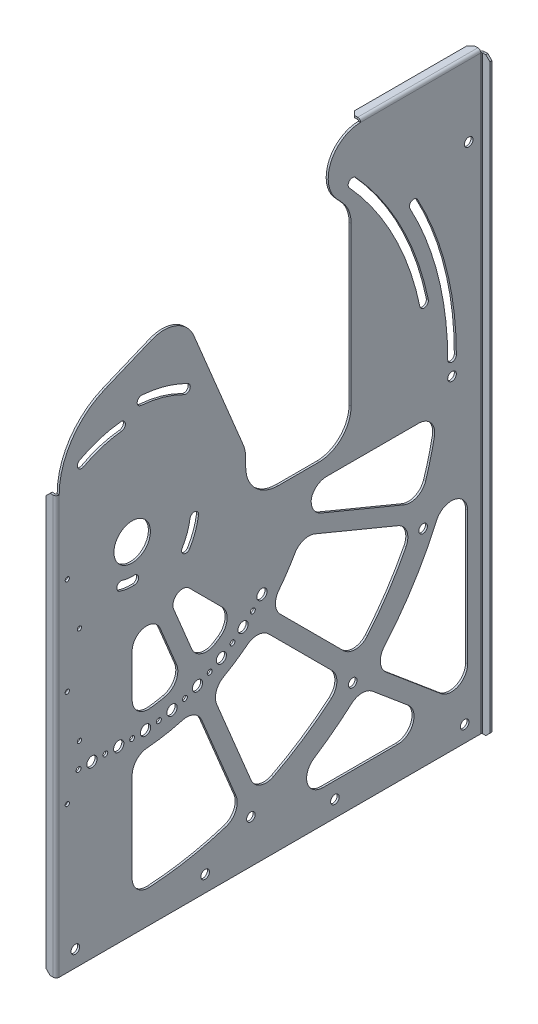
from build123d import *

# Parameters (mm, degrees)
SKETCH1_W                 = 330.2
SKETCH1_H                 = 558.8
BASE_FLANGE1_DEPTH        = 1.5875
SKETCH7_R                 = 3.3782
CUT_EXTRUDE1_DEPTH        = 650.070104192
SKETCH11_R                = 3.3782
CUT_EXTRUDE2_DEPTH        = 650.070104192
CUT_EXTRUDE3_DEPTH        = 650.070104192
CUT_EXTRUDE3_DEPTH_BACK   = 650.070104192
SKETCH20_R                = 1.651
CUT_EXTRUDE5_DEPTH        = 2.54
EDGE_FLANGE3_DEPTH        = 327.025
EDGE_FLANGE4_DEPTH        = 491.294820266
SKETCH34_R                = 14.2875
CUT_EXTRUDE6_DEPTH        = 594.74051043
CUT_EXTRUDE7_DEPTH        = 594.74051043
CUT_EXTRUDE15_DEPTH       = 594.74051043
CUT_EXTRUDE10_DEPTH       = 594.74051043
CUT_EXTRUDE11_DEPTH       = 594.74051043
CUT_EXTRUDE13_DEPTH       = 594.74051043
FILLET2_R                 = 12.7
FILLET3_START             = -1.5875
FILLET3_DEPTH             = 1.5875
FILLET5_START             = -1.5875
FILLET5_DEPTH             = 1.5875
SKETCH56_R                = 1.905
SKETCH56_R_2              = 4
CUT_EXTRUDE14_DEPTH       = 594.740510512
FILLET6_R                 = 25.4
CUT_EXTRUDE16_DEPTH       = 594.740510512
CUT_EXTRUDE16_DEPTH_BACK  = 594.740510512
EDGE_FLANGE7_DEPTH        = 94.134987421
BREAK_CORNER1_START       = 328.750604804
BREAK_CORNER1_OUTLINE_W   = 324
BREAK_CORNER1_OUTLINE_H   = 338
BREAK_CORNER1_DEPTH       = 3.249395196
BREAK_CORNER1_START_2     = -5.612660076
BREAK_CORNER1_2_OUTLINE_W = 324
BREAK_CORNER1_2_OUTLINE_H = 338
BREAK_CORNER1_2_DEPTH     = 2.245064031
BREAK_CORNER1_START_3     = 2.24506403
BREAK_CORNER1_3_OUTLINE_W = 228
BREAK_CORNER1_3_OUTLINE_H = 338
BREAK_CORNER1_3_DEPTH     = 2.75493597
BREAK_CORNER1_START_4     = -236.854255193
BREAK_CORNER1_4_OUTLINE_W = 228
BREAK_CORNER1_4_OUTLINE_H = 338
BREAK_CORNER1_4_DEPTH     = 2.24506403
BREAK_CORNER1_START_5     = -240
BREAK_CORNER1_5_OUTLINE_W = 8
BREAK_CORNER1_5_OUTLINE_H = 5
BREAK_CORNER1_5_DEPTH     = 3.145744807
BREAK_CORNER1_START_6     = 160
BREAK_CORNER1_6_OUTLINE_W = 7
BREAK_CORNER1_6_OUTLINE_H = 5
BREAK_CORNER1_6_DEPTH     = 3.55557515


with BuildPart() as part:
    # Base-Flange1: sheet metal written as solids
    # Sketch1 → Base-Flange1 (new body)
    with BuildSketch(Plane(origin=(0, 0, 0), x_dir=(0, 0, -1), z_dir=(1, 0, 0))):
        with Locations((165.1, 279.4)):
            Rectangle(SKETCH1_W, SKETCH1_H)
    extrude(amount=-BASE_FLANGE1_DEPTH)

    # Sketch7 → Cut-Extrude1 (cut, through all)
    with BuildSketch(Plane(origin=(0, 0, 0), x_dir=(0, 0, -1), z_dir=(1, 0, 0))):
        with Locations((12.7, 12.7)):
            Circle(SKETCH7_R)
        with Locations((114.3, 12.7)):
            Circle(SKETCH7_R)
        with Locations((215.9, 12.7)):
            Circle(SKETCH7_R)
        with Locations((317.5, 12.7)):
            Circle(SKETCH7_R)
    extrude(amount=-CUT_EXTRUDE1_DEPTH, mode=Mode.SUBTRACT)

    # Sketch11 → Cut-Extrude2 (cut, through all)
    with BuildSketch(Plane(origin=(0, 0, 0), x_dir=(0, 0, -1), z_dir=(1, 0, 0))):
        with Locations((150.127153555, 33.744146797)):
            Circle(SKETCH11_R)
        with Locations((229.85664515, 84.805537891)):
            Circle(SKETCH11_R)
        with Locations((284.978379186, 161.78379409)):
            Circle(SKETCH11_R)
        with Locations((307.638446704, 253.710824013)):
            Circle(SKETCH11_R)
        with Locations((320.675, 406.110824013)):
            Circle(SKETCH11_R)
    extrude(amount=-CUT_EXTRUDE2_DEPTH, mode=Mode.SUBTRACT)

    # Sketch12 → Cut-Extrude3 (cut, two sides: drawn at the far end of the back side and taken through both)
    with BuildSketch(Plane(origin=(0, 0, 0), x_dir=(0, 0, -1), z_dir=(1, 0, 0)).offset(-CUT_EXTRUDE3_DEPTH_BACK)):
        with BuildLine():
            Line((0, -866.871347525), (0, 327.025))
            ThreePointArc((0, 327.025), (9.845545249, 359.481413013), (36.063633881, 380.998042289))
            Line((36.063633881, 380.998042289), (287.873339559, 485.301037518))
            ThreePointArc((287.873339559, 485.301037518), (308.657009809, 490.978996813), (330.2, 491.294820266))
            Line((330.2, 491.294820266), (1516.701976399, 358.623992149))
            Line((1516.701976399, 358.623992149), (16.017291967, 2215.906801104))
            Line((16.017291967, 2215.906801104), (-1500.684684433, 990.41146143))
            Line((-1500.684684433, 990.41146143), (0, -866.871347525))
        make_face()
    extrude(amount=CUT_EXTRUDE3_DEPTH + CUT_EXTRUDE3_DEPTH_BACK, mode=Mode.SUBTRACT)

    # Sketch20 → Cut-Extrude5 (cut)
    with BuildSketch(Plane.ZY.offset(1.5875)):
        with Locations((-6.35, 114.3)):
            Circle(SKETCH20_R)
        with Locations((-15.875, 152.4)):
            Circle(SKETCH20_R)
        with Locations((-6.35, 190.5)):
            Circle(SKETCH20_R)
        with Locations((-15.875, 228.6)):
            Circle(SKETCH20_R)
        with Locations((-6.35, 266.7)):
            Circle(SKETCH20_R)
    extrude(amount=-CUT_EXTRUDE5_DEPTH, mode=Mode.SUBTRACT)

    # Edge-Flange3: sheet metal written as solids
    # Edge-Flange3 section (on a plane across the edge) → Edge-Flange3 (add)
    with BuildSketch(Plane(origin=(-1.5875, 0, 0.7366), x_dir=(0, 0, -1), z_dir=(0, 1, 0))):
        with BuildLine():
            Line((-1.5875, 0.7366), (-1.5875, 6.35))
            Line((-1.5875, 6.35), (0, 6.35))
            Line((0, 6.35), (0, 0.7366))
            ThreePointArc((0, 0.7366), (0.215745145, 0.215745145), (0.7366, 0))
            Line((0.7366, 0), (0.7366, -1.5875))
            ThreePointArc((0.7366, -1.5875), (-0.90678687, -0.90678687), (-1.5875, 0.7366))
        make_face()
    extrude(amount=EDGE_FLANGE3_DEPTH)

    # Edge-Flange4: sheet metal written as solids
    # Edge-Flange4 section (on a plane across the edge) → Edge-Flange4 (add)
    with BuildSketch(Plane(origin=(0, 0, -330.9366), x_dir=(0, 0, 1), z_dir=(0, 1, 0))):
        with BuildLine():
            Line((-1.5875, 0.7366), (-1.5875, 6.35))
            Line((-1.5875, 6.35), (0, 6.35))
            Line((0, 6.35), (0, 0.7366))
            ThreePointArc((0, 0.7366), (0.215745145, 0.215745145), (0.7366, 0))
            Line((0.7366, 0), (0.7366, -1.5875))
            ThreePointArc((0.7366, -1.5875), (-0.90678687, -0.90678687), (-1.5875, 0.7366))
        make_face()
    extrude(amount=EDGE_FLANGE4_DEPTH)

    # Sketch34 → Cut-Extrude6 (cut, through all)
    with BuildSketch(Plane.ZY.offset(1.5875)):
        with Locations((-57.15, 266.7)):
            Circle(SKETCH34_R)
    extrude(amount=-CUT_EXTRUDE6_DEPTH, mode=Mode.SUBTRACT)

    # Sketch35 → Cut-Extrude7 (cut, through all)
    with BuildSketch(Plane(origin=(0, 0, 0), x_dir=(0, 0, -1), z_dir=(1, 0, 0))):
        with BuildLine():
            Line((228.6, 406.4), (228.6, 247.65))
            Line((228.6, 247.65), (146.05, 247.65))
            Line((146.05, 247.65), (146.05, 284.38330946))
            Line((146.05, 284.38330946), (95.784403228, 405.735194908))
            Line((95.784403228, 405.735194908), (188.923415984, 444.314637178))
            ThreePointArc((188.923415984, 444.314637178), (209.942309782, 426.592784614), (228.6, 406.4))
        make_face()
    extrude(amount=-CUT_EXTRUDE7_DEPTH, mode=Mode.SUBTRACT)

    # Sketch57 → Cut-Extrude15 (cut, through all)
    with BuildSketch(Plane.ZY.offset(1.5875)):
        with BuildLine():
            ThreePointArc((-64.745880713, 362.454760351), (-83.280755026, 359.132976667), (-100.811439078, 352.259045526))
            ThreePointArc((-100.811439078, 352.259045526), (-102.284945526, 347.714460922), (-97.740360922, 346.240954474))
            ThreePointArc((-97.740360922, 346.240954474), (-81.442758096, 352.63138392), (-64.211598201, 355.719518473))
            ThreePointArc((-64.211598201, 355.719518473), (-61.111118518, 359.354280668), (-64.745880713, 362.454760351))
        make_face()
        with BuildLine():
            ThreePointArc((-15.933801681, 342.615684562), (-31.536174722, 349.197867372), (-48.122872704, 352.609703405))
            ThreePointArc((-48.122872704, 352.609703405), (-51.835603405, 349.603027296), (-48.828927296, 345.890296595))
            ThreePointArc((-48.828927296, 345.890296595), (-33.539553912, 342.745316498), (-19.157516729, 336.677957535))
            ThreePointArc((-19.157516729, 336.677957535), (-14.576795692, 338.034963524), (-15.933801681, 342.615684562))
        make_face()
        with BuildLine():
            ThreePointArc((-59.071100472, 236.542659122), (-53.150781722, 236.747335861), (-47.384150688, 238.103076685))
            ThreePointArc((-47.384150688, 238.103076685), (-45.278976685, 242.391749312), (-49.567649312, 244.496923315))
            ThreePointArc((-49.567649312, 244.496923315), (-54.044947435, 243.44430597), (-58.641570986, 243.285391905))
            ThreePointArc((-58.641570986, 243.285391905), (-62.227702121, 240.128790257), (-59.071100472, 236.542659122))
        make_face()
        with BuildLine():
            ThreePointArc((-109.129737949, 258.849879422), (-106.599479308, 248.859973473), (-102.168904909, 239.555649738))
            ThreePointArc((-102.168904909, 239.555649738), (-97.531549738, 238.406995091), (-96.382895091, 243.044350262))
            ThreePointArc((-96.382895091, 243.044350262), (-100.244034338, 251.152845075), (-102.449094012, 259.858808334))
            ThreePointArc((-102.449094012, 259.858808334), (-106.293880437, 262.694665846), (-109.129737949, 258.849879422))
        make_face()
    extrude(amount=-CUT_EXTRUDE15_DEPTH, mode=Mode.SUBTRACT)

    # Sketch38 → Cut-Extrude10 (cut, through all)
    with BuildSketch(Plane(origin=(0, 0, 0), x_dir=(0, 0, -1), z_dir=(1, 0, 0))):
        with BuildLine():
            ThreePointArc((289.064689163, 315.013976618), (268.092830185, 374.504386644), (232.164694081, 426.351245663))
            ThreePointArc((232.164694081, 426.351245663), (227.392224016, 426.570334578), (227.173135101, 421.797864512))
            ThreePointArc((227.173135101, 421.797864512), (262.076572042, 371.429719358), (282.450296837, 313.636023382))
            ThreePointArc((282.450296837, 313.636023382), (286.446469618, 311.017803837), (289.064689163, 315.013976618))
        make_face()
        with BuildLine():
            ThreePointArc((311.016646704, 266.7), (303.30330924, 328.803322446), (280.632012024, 387.132821982))
            ThreePointArc((280.632012024, 387.132821982), (276.055542025, 388.504096147), (274.684267861, 383.927626148))
            ThreePointArc((274.684267861, 383.927626148), (296.752191793, 327.150506319), (304.260246704, 266.7))
            ThreePointArc((304.260246704, 266.7), (307.638446704, 263.3218), (311.016646704, 266.7))
        make_face()
    extrude(amount=-CUT_EXTRUDE10_DEPTH, mode=Mode.SUBTRACT)

    # Sketch53 → Cut-Extrude11 (cut, through all)
    with BuildSketch(Plane.ZY.offset(1.5875)):
        with BuildLine():
            Line((-298.960697357, 42.906473463), (-256.016687282, 78.940776478))
            ThreePointArc((-256.016687282, 78.940776478), (-251.521954036, 87.639203195), (-254.550783417, 96.950027375))
            ThreePointArc((-254.550783417, 96.950027375), (-277.434716533, 127.931249332), (-295.497397674, 161.949627581))
            ThreePointArc((-295.497397674, 161.949627581), (-309.734739813, 169.268632813), (-319.8241, 156.839853317))
            Line((-319.8241, 156.839853317), (-319.8241, 52.63523789))
            ThreePointArc((-319.8241, 52.63523789), (-312.491351924, 41.125128995), (-298.960697357, 42.906473463))
        make_face()
        with BuildLine():
            Line((-245.450006116, 71.228602173), (-273.336846815, 47.828764428))
            ThreePointArc((-273.336846815, 47.828764428), (-277.107540456, 33.75634418), (-265.173444172, 25.4))
            Line((-265.173444172, 25.4), (-206.476295407, 25.4))
            ThreePointArc((-206.476295407, 25.4), (-194.304124517, 34.476706496), (-199.530886318, 48.73255814))
            ThreePointArc((-199.530886318, 48.73255814), (-214.615186825, 59.367326651), (-228.9081568, 71.044031339))
            ThreePointArc((-228.9081568, 71.044031339), (-237.144908088, 74.199047265), (-245.450006116, 71.228602173))
        make_face()
    extrude(amount=-CUT_EXTRUDE11_DEPTH, mode=Mode.SUBTRACT)

    # Sketch55 → Cut-Extrude13 (cut, through all)
    with BuildSketch(Plane.ZY.offset(1.5875)):
        with BuildLine():
            Line((-57.15, 203.2), (-57.15, 146.05))
            ThreePointArc((-57.15, 146.05), (-77.564417304, 147.789638525), (-97.390128321, 152.958386803))
            Line((-97.390128321, 152.958386803), (-75.461955651, 205.897678661))
            ThreePointArc((-75.461955651, 205.897678661), (-66.404798619, 203.878039648), (-57.15, 203.2))
        make_face()
        with BuildLine():
            Line((-189.524970055, 204.995301613), (-277.574885464, 168.523832484))
            ThreePointArc((-277.574885464, 168.523832484), (-257.783617449, 132.640902772), (-232.205903496, 100.624352625))
            Line((-232.205903496, 100.624352625), (-164.815415799, 168.014840322))
            ThreePointArc((-164.815415799, 168.014840322), (-178.586136877, 185.558967467), (-189.524970055, 204.995301613))
        make_face()
        with BuildLine():
            Line((-97.336082052, 217.533661827), (-137.854061882, 177.015681997))
            ThreePointArc((-137.854061882, 177.015681997), (-124.179548614, 166.383191276), (-109.123398384, 157.818466394))
            Line((-109.123398384, 157.818466394), (-87.195225714, 210.757758252))
            ThreePointArc((-87.195225714, 210.757758252), (-92.428709797, 213.901679619), (-97.336082052, 217.533661827))
        make_face()
        with BuildLine():
            Line((-155.835159678, 159.034584201), (-223.225647375, 91.644096504))
            ThreePointArc((-223.225647375, 91.644096504), (-191.209097228, 66.066382551), (-155.326167516, 46.275114536))
            Line((-155.326167516, 46.275114536), (-118.854698387, 134.325029945))
            ThreePointArc((-118.854698387, 134.325029945), (-138.291032533, 145.263863123), (-155.835159678, 159.034584201))
        make_face()
        with BuildLine():
            Line((-107.121428324, 129.464950354), (-143.592897453, 41.415034945))
            ThreePointArc((-143.592897453, 41.415034945), (-101.106955833, 29.437537664), (-57.15, 25.4))
            Line((-57.15, 25.4), (-57.15, 120.65))
            ThreePointArc((-57.15, 120.65), (-82.521475117, 122.870619308), (-107.121428324, 129.464950354))
        make_face()
        with BuildLine():
            Line((-194.385049646, 216.728571676), (-282.434965055, 180.257102547))
            ThreePointArc((-282.434965055, 180.257102547), (-290.997981253, 207.195280322), (-296.352064163, 234.95))
            Line((-296.352064163, 234.95), (-199.707146436, 234.95))
            ThreePointArc((-199.707146436, 234.95), (-197.342451151, 225.752727314), (-194.385049646, 216.728571676))
        make_face()
    extrude(amount=-CUT_EXTRUDE13_DEPTH, mode=Mode.SUBTRACT)

    # Fillet2
    # the kernel refuses this fillet: 12.7 mm, written as the material it adds along each edge
    with BuildSketch(Plane(origin=(-1.5875, 157.818466394, -109.123398384), x_dir=(0, 0.9238795325112882, 0.38268343236508645), z_dir=(1, 0, 0))) as fillet2_piece_1:
        with BuildLine():
            CenterArc((14.226955483, -12.7), FILLET2_R, 90, 100.164248622)
            ThreePointArc((1.72627038, -14.941176471), (0.630082435, -7.497514634), (0, 0))
            Line((0, 0), (14.226955483, 0))
        make_face()
    extrude(amount=1.5875)
    with BuildSketch(Plane(origin=(-1.5875, 177.015681997, -137.854061882), x_dir=(0, -0.6212762774980769, 0.7835915945300412), z_dir=(1, 0, 0)), Plane(origin=(-1.5875, 152.958386803, -97.390128321), x_dir=(0, -0.27411691584808684, 0.961696374354158), z_dir=(1, 0, 0))) as fillet2_piece_2:
        with BuildLine():
            CenterArc((14.248961614, -12.675304936), FILLET2_R, 86.426356344, 100.164248622)
            Line((1.632888307, -14.132938055), (0, 0))
            ThreePointArc((0, 0), (7.520285296, 0.234603106), (15.040570593, 0))
        make_face()
    extrude(amount=1.5875)
    with BuildSketch(Plane(origin=(-1.5875, 204.995301613, -189.524970055), x_dir=(0, -0.3826834323650902, -0.9238795325112866), z_dir=(1, 0, 0)), Plane(origin=(-1.5875, 159.034584201, -155.835159678), x_dir=(0, -0.7071067811865488, -0.7071067811865464), z_dir=(1, 0, 0)), Plane(origin=(-1.5875, 129.464950354, -107.121428324), x_dir=(0, -0.9238795325112877, -0.3826834323650873), z_dir=(1, 0, 0))) as fillet2_piece_3:
        with BuildLine():
            CenterArc((11.690964082, -12.7), FILLET2_R, 90, 83.107897421)
            ThreePointArc((-0.917264342, -11.176), (-0.351332304, -5.59680658), (0, 0))
            Line((0, 0), (11.690964082, 0))
        make_face()
    extrude(amount=1.5875)
    with BuildSketch(Plane(origin=(-1.5875, 168.014840322, -164.815415799), x_dir=(0, 0.7625780638873113, -0.6468962022441309), z_dir=(1, 0, 0)), Plane(origin=(-1.5875, 216.728571676, -194.385049646), x_dir=(0, 0.9520867242262976, -0.3058281699779108), z_dir=(1, 0, 0))) as fillet2_piece_4:
        with BuildLine():
            CenterArc((11.701125722, -12.690638204), FILLET2_R, 92.200098105, 83.107897421)
            Line((-0.956314184, -11.651785458), (0, 0))
            ThreePointArc((0, 0), (5.606789408, -0.107660658), (11.213578816, 0))
        make_face()
    extrude(amount=1.5875)
    with BuildSketch(Plane(origin=(-1.5875, 100.624352625, -232.205903496), x_dir=(0, 0.7071067811865497, 0.7071067811865455), z_dir=(1, 0, 0)), Plane(origin=(-1.5875, 46.275114536, -155.326167516), x_dir=(0, 0.9238795325112885, 0.38268343236508523), z_dir=(1, 0, 0))) as fillet2_piece_5:
        with BuildLine():
            CenterArc((13.411565742, -12.7), FILLET2_R, 90, 94.780191847)
            ThreePointArc((0.755739789, -13.758333333), (0.279643753, -6.88456219), (0, 0))
            Line((0, 0), (13.411565742, 0))
        make_face()
    extrude(amount=1.5875)
    with BuildSketch(Plane(origin=(-1.5875, 168.523832484, -277.574885464), x_dir=(0, 0.38268343236509145, 0.9238795325112861), z_dir=(1, 0, 0))) as fillet2_piece_6:
        with BuildLine():
            CenterArc((13.411565742, 12.7), FILLET2_R, 175.219808153, 94.780191847)
            ThreePointArc((0.755739789, 13.758333333), (0.279643753, 6.88456219), (0, 0))
            Line((0, 0), (13.411565742, 0))
        make_face()
    extrude(amount=1.5875)
    with BuildSketch(Plane(origin=(-1.5875, 180.257102547, -282.434965055), x_dir=(0, 0.9434778939283668, -0.3314354592805266), z_dir=(1, 0, 0))) as fillet2_piece_7:
        with BuildLine():
            CenterArc((13.416466734, 12.69482241), FILLET2_R, 176.855925199, 94.780191847)
            Line((0.735583095, 13.391378314), (0, 0))
            ThreePointArc((0, 0), (6.889536972, -0.098374217), (13.779073943, 0))
        make_face()
    extrude(amount=1.5875)
    with BuildSketch(Plane(origin=(-1.5875, 234.95, -296.352064163), x_dir=(0, -0.9866104538963909, 0.16309448875531526), z_dir=(1, 0, 0))) as fillet2_piece_8:
        with BuildLine():
            CenterArc((14.970699408, -12.693553006), FILLET2_R, 88.17428588, 101.212271418)
            Line((2.440746643, -14.764853013), (0, 0))
            ThreePointArc((0, 0), (7.687656453, 0.122492885), (15.375312905, 0))
        make_face()
    extrude(amount=1.5875)
    with BuildSketch(Plane(origin=(-1.5875, 234.95, -199.707146436), x_dir=(0, 0, -1), z_dir=(1, 0, 0))) as fillet2_piece_9:
        with BuildLine():
            CenterArc((9.842853564, -12.7), FILLET2_R, 90, 73.739795292)
            ThreePointArc((-2.349146436, -9.144), (-1.100668346, -4.590986589), (0, 0))
            Line((0, 0), (9.842853564, 0))
        make_face()
    extrude(amount=1.5875)
    with BuildSketch(Plane(origin=(-1.5875, 146.05, -57.15), x_dir=(0, 1, 0), z_dir=(1, 0, 0))) as fillet2_piece_10:
        with BuildLine():
            CenterArc((13.449661848, -12.7), FILLET2_R, 90, 96.756327031)
            ThreePointArc((0.837857359, -14.194117647), (0.209646485, -7.109412436), (0, 0))
            Line((0, 0), (13.449661848, 0))
        make_face()
    extrude(amount=1.5875)
    with BuildSketch(Plane(origin=(-1.5875, 134.325029945, -118.854698387), x_dir=(0, -0.9238795325112877, -0.38268343236508745), z_dir=(1, 0, 0))) as fillet2_piece_11:
        with BuildLine():
            CenterArc((11.690964082, 12.7), FILLET2_R, 186.892102579, 83.107897421)
            ThreePointArc((-0.917264342, 11.176), (-0.351332304, 5.59680658), (0, 0))
            Line((0, 0), (11.690964082, 0))
        make_face()
    extrude(amount=1.5875)
    with BuildSketch(Plane(origin=(-1.5875, 91.644096504, -223.225647375), x_dir=(0, -0.6672597959868466, 0.744825056412304), z_dir=(1, 0, 0)), Plane(origin=(-1.5875, 41.415034945, -143.592897453), x_dir=(0, -0.3314354592805216, 0.9434778939283684), z_dir=(1, 0, 0))) as fillet2_piece_12:
        with BuildLine():
            CenterArc((13.416466734, -12.69482241), FILLET2_R, 88.363882954, 94.780191847)
            Line((0.735583095, -13.391378314), (0, 0))
            ThreePointArc((0, 0), (6.889536972, 0.098374217), (13.779073943, 0))
        make_face()
    extrude(amount=1.5875)
    with BuildSketch(Plane(origin=(-1.5875, 25.4, -57.15), x_dir=(0, 1, 0), z_dir=(1, 0, 0))) as fillet2_piece_13:
        with BuildLine():
            CenterArc((13.053050404, -12.7), FILLET2_R, 90, 93.184738537)
            ThreePointArc((0.372664315, -13.405555556), (0.093184071, -6.705367224), (0, 0))
            Line((0, 0), (13.053050404, 0))
        make_face()
    extrude(amount=1.5875)
    with BuildSketch(Plane(origin=(-1.5875, 120.65, -57.15), x_dir=(0, -1, 0), z_dir=(1, 0, 0))) as fillet2_piece_14:
        with BuildLine():
            CenterArc((12.191184589, 12.7), FILLET2_R, 184.588565736, 85.411434264)
            ThreePointArc((-0.468110178, 11.684), (-0.117074468, 5.846686736), (0, 0))
            Line((0, 0), (12.191184589, 0))
        make_face()
    extrude(amount=1.5875)

    # Fillet3: read off the stored shape, not the designer's step
    # Fillet3 outline → Fillet3 (add)
    with BuildSketch(Plane.YZ.offset(FILLET3_START)):
        with BuildLine():
            add(Edge.make_bspline(
                [(203.943071786, -66.83596723), (202.95256285, -60.41830005), (197.939789665, -57.15), (192.647476654, -57.15)],
                knots=[0.486832971, 0.486832971, 0.486832971, 0.486832971, 1, 1, 1, 1], degree=3, weights=[0.597824256, 0.59057268, 0.724631261, 1]))
            ThreePointArc((203.943071786, -66.83596723), (203.386040475, -62.007214141), (203.2, -57.15))
            Line((203.2, -57.15), (192.647476654, -57.15))
        make_face()
        with BuildLine():
            add(Edge.make_bspline(
                [(197.021295817, -79.138673809), (201.571118323, -77.254075621), (204.860792128, -72.782025362), (203.943071786, -66.83596723)],
                knots=[0, 0, 0, 0, 0.486832971, 0.486832971, 0.486832971, 0.486832971], degree=3, weights=[1, 0.738762287, 0.604703706, 0.597824256]))
            Line((197.021295817, -79.138673809), (205.897678661, -75.461955651))
            ThreePointArc((205.897678661, -75.461955651), (204.770007617, -71.183034006), (203.943071786, -66.83596723))
        make_face()
    extrude(amount=FILLET3_DEPTH)

    # Fillet5: read off the stored shape, not the designer's step
    # Fillet5 outline → Fillet5 (add)
    with BuildSketch(Plane.YZ.offset(FILLET5_START)):
        with BuildLine():
            add(Edge.make_bspline(
                [(213.901679688, -92.4287099), (211.621422627, -89.016063921), (207.890105253, -88.383046478), (204.793400573, -89.665743555)],
                knots=[0.499999995, 0.499999995, 0.499999995, 0.499999995, 1, 1, 1, 1], degree=3, weights=[0.597545161, 0.597545158, 0.731696771, 1]))
            ThreePointArc((213.901679688, -92.4287099), (212.266785889, -89.849773723), (210.757758252, -87.195225714))
            Line((210.757758252, -87.195225714), (204.793400573, -89.665743555))
        make_face()
        with BuildLine():
            add(Edge.make_bspline(
                [(212.968740091, -101.901003788), (215.338855177, -99.530888702), (216.181936682, -95.84135578), (213.901679688, -92.4287099)],
                knots=[0, 0, 0, 0, 0.499999995, 0.499999995, 0.499999995, 0.499999995], degree=3, weights=[1, 0.731696777, 0.597545164, 0.597545161]))
            Line((212.968740091, -101.901003788), (217.533661827, -97.336082052))
            ThreePointArc((217.533661827, -97.336082052), (215.658659203, -94.92607086), (213.901679688, -92.4287099))
        make_face()
    extrude(amount=FILLET5_DEPTH)

    # Sketch56 → Cut-Extrude14 (cut, through all)
    with BuildSketch(Plane.ZY.offset(1.5875)):
        with Locations((-57.15, 133.35)):
            Circle(SKETCH56_R)
        with Locations((-67.641859328, 133.763385827)):
            Circle(SKETCH56_R_2)
        with Locations((-78.068668998, 135.00098031)):
            Circle(SKETCH56_R)
        with Locations((-88.365782661, 137.055110348)):
            Circle(SKETCH56_R_2)
        with Locations((-98.469358084, 139.91304031)):
            Circle(SKETCH56_R)
        with Locations((-108.316752975, 143.557050994)):
            Circle(SKETCH56_R_2)
        with Locations((-117.846913363, 147.964549488)):
            Circle(SKETCH56_R)
        with Locations((-127.000752135, 153.108209249)):
            Circle(SKETCH56_R_2)
        with Locations((-135.721515378, 158.95613952)):
            Circle(SKETCH56_R)
        with Locations((-143.955134252, 165.472083062)):
            Circle(SKETCH56_R_2)
        with Locations((-46.65, 133.35)):
            Circle(SKETCH56_R_2)
        with Locations((-36.15, 133.35)):
            Circle(SKETCH56_R)
        with Locations((-151.650560216, 172.615640945)):
            Circle(SKETCH56_R)
        with Locations((-158.760081536, 180.34252302)):
            Circle(SKETCH56_R_2)
        with Locations((-25.65, 133.35)):
            Circle(SKETCH56_R_2)
        with Locations((-15.15, 133.35)):
            Circle(SKETCH56_R)
    extrude(amount=-CUT_EXTRUDE14_DEPTH, mode=Mode.SUBTRACT)

    # Fillet6
    fillet6_edges = [part.edges().sort_by_distance(p)[0] for p in [
        (-0.79375, 405.735194908, -95.784403228),
        (-0.79375, 444.314637178, -188.923415984),
        (-0.79375, 406.4, -228.6),
        (-0.79375, 247.65, -228.6),
        (-0.79375, 247.65, -146.05),
        (-0.79375, 284.38330946, -146.05),
    ]]
    fillet(fillet6_edges, radius=FILLET6_R)

    # Sketch58 → Cut-Extrude16 (cut, two sides: drawn at the far end of the back side and taken through both)
    with BuildSketch(Plane(origin=(0, 0, 0), x_dir=(0, 0, -1), z_dir=(1, 0, 0)).offset(-CUT_EXTRUDE16_DEPTH_BACK)):
        with BuildLine():
            Line((396.451893086, 461.748563952), (236.065012579, 461.748563952))
            ThreePointArc((236.065012579, 461.748563952), (231.109718399, 461.260510074), (226.344853397, 459.815104077))
            Line((226.344853397, 459.815104077), (226.344853397, 491.825693451))
            Line((226.344853397, 491.825693451), (396.451893086, 491.825693451))
            Line((396.451893086, 491.825693451), (396.451893086, 461.748563952))
        make_face()
    extrude(amount=CUT_EXTRUDE16_DEPTH + CUT_EXTRUDE16_DEPTH_BACK, mode=Mode.SUBTRACT)

    # Edge-Flange7: sheet metal written as solids
    # Edge-Flange7 section (on a plane across the edge) → Edge-Flange7 (add)
    with BuildSketch(Plane(origin=(-1.5875, 462.485163952, -236.065012579), x_dir=(0, -1, 0), z_dir=(0, 0, -1))):
        with BuildLine():
            Line((-1.5875, 0.7366), (-1.5875, 6.35))
            Line((-1.5875, 6.35), (0, 6.35))
            Line((0, 6.35), (0, 0.7366))
            ThreePointArc((0, 0.7366), (0.215745145, 0.215745145), (0.7366, 0))
            Line((0.7366, 0), (0.7366, -1.5875))
            ThreePointArc((0.7366, -1.5875), (-0.90678687, -0.90678687), (-1.5875, 0.7366))
        make_face()
    extrude(amount=EDGE_FLANGE7_DEPTH)

    # Break-Corner1: read off the stored shape, not the designer's step
    # Break-Corner1 outline → Break-Corner1 (cut)
    with BuildSketch(Plane(origin=(0, 0, 0), x_dir=(0.707106781186546, -0.707106781186549, 0), z_dir=(0.707106781186549, 0.707106781186546, 0)).offset(BREAK_CORNER1_START)):
        with Locations((-164, 165)):
            Rectangle(BREAK_CORNER1_OUTLINE_W, BREAK_CORNER1_OUTLINE_H)
    extrude(amount=BREAK_CORNER1_DEPTH, mode=Mode.SUBTRACT)

    # Break-Corner1 2 outline → Break-Corner1 2 (cut)
    with BuildSketch(Plane(origin=(0, 0, 0), x_dir=(0.707106781186546, -0.707106781186549, 0), z_dir=(0.707106781186549, 0.707106781186546, 0)).offset(BREAK_CORNER1_START_2)):
        with Locations((-164, 165)):
            Rectangle(BREAK_CORNER1_2_OUTLINE_W, BREAK_CORNER1_2_OUTLINE_H)
    extrude(amount=BREAK_CORNER1_2_DEPTH, mode=Mode.SUBTRACT)

    # Break-Corner1 3 outline → Break-Corner1 3 (cut)
    with BuildSketch(Plane(origin=(0, 0, 0), x_dir=(0.7071067811865509, 0.707106781186544, 0), z_dir=(0.707106781186544, -0.707106781186551, 0)).offset(BREAK_CORNER1_START_3)):
        with Locations((115, -165)):
            Rectangle(BREAK_CORNER1_3_OUTLINE_W, BREAK_CORNER1_3_OUTLINE_H)
    extrude(amount=BREAK_CORNER1_3_DEPTH, mode=Mode.SUBTRACT)

    # Break-Corner1 4 outline → Break-Corner1 4 (cut)
    with BuildSketch(Plane(origin=(0, 0, 0), x_dir=(0.7071067811865509, 0.707106781186544, 0), z_dir=(0.707106781186544, -0.707106781186551, 0)).offset(BREAK_CORNER1_START_4)):
        with Locations((115, -165)):
            Rectangle(BREAK_CORNER1_4_OUTLINE_W, BREAK_CORNER1_4_OUTLINE_H)
    extrude(amount=BREAK_CORNER1_4_DEPTH, mode=Mode.SUBTRACT)

    # Break-Corner1 5 outline → Break-Corner1 5 (cut)
    with BuildSketch(Plane(origin=(0, 0, 0), x_dir=(0.707106781186546, 0, -0.707106781186549), z_dir=(0.707106781186549, 0, 0.707106781186546)).offset(BREAK_CORNER1_START_5)):
        with Locations((228, 463.5)):
            Rectangle(BREAK_CORNER1_5_OUTLINE_W, BREAK_CORNER1_5_OUTLINE_H)
    extrude(amount=BREAK_CORNER1_5_DEPTH, mode=Mode.SUBTRACT)

    # Break-Corner1 6 outline → Break-Corner1 6 (cut)
    with BuildSketch(Plane(origin=(0, 0, 0), x_dir=(0.707106781186548, 0, 0.707106781186547), z_dir=(0.707106781186547, 0, -0.707106781186548)).offset(BREAK_CORNER1_START_6)):
        with Locations((-172.5, -463.5)):
            Rectangle(BREAK_CORNER1_6_OUTLINE_W, BREAK_CORNER1_6_OUTLINE_H)
    extrude(amount=BREAK_CORNER1_6_DEPTH, mode=Mode.SUBTRACT)


solid = part.part
